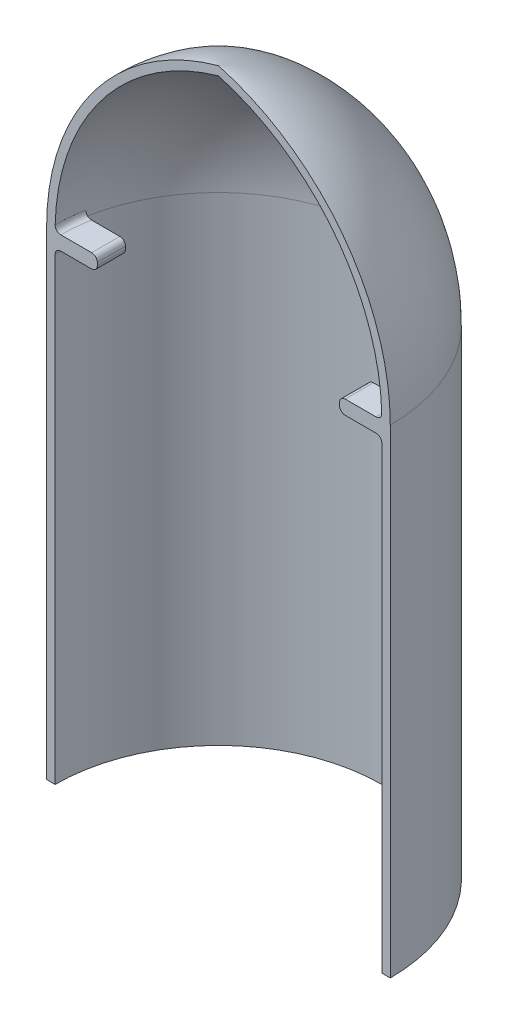
from build123d import *

# Parameters (mm, degrees)
REVOLVE1_ANGLE      = 180
SKETCH2_W           = 15
SKETCH2_H           = 5
BOSS_EXTRUDE1_DEPTH = 10
FILLET2_R           = 2
FILLET3_R           = 2
FILLET4_R           = 2
FILLET5_R           = 2
FILLET6_R           = 2


with BuildPart() as part:
    # Sketch1 → Revolve1 (revolve)
    with BuildSketch(Plane.XY):
        with BuildLine():
            Line((61, 170), (61, 0))
            Line((61, 0), (58, 0))
            Line((58, 0), (58, 170))
            ThreePointArc((58, 170), (41.873834296, 218.154039035), (0, 246.884627213))
            Line((0, 246.884627213), (0, 250))
            ThreePointArc((0, 250), (44.010282534, 220.301590432), (61, 170))
        make_face()
    revolve(axis=Axis((0, 0, 0), (0, 1, 0)), revolution_arc=REVOLVE1_ANGLE)

    # Sketch2 → Boss-Extrude1 (add)
    with BuildSketch(Plane.XY):
        with Locations((50.5, 167.5)):
            Rectangle(SKETCH2_W, SKETCH2_H)
        with Locations((-50.5, 167.5)):
            Rectangle(SKETCH2_W, SKETCH2_H)
    extrude(amount=-BOSS_EXTRUDE1_DEPTH)

    # Fillet2
    # the kernel refuses this fillet: 2 mm, written as the material it adds along each edge
    with BuildSketch(Plane(origin=(0, 170, 0), x_dir=(1, 0, 0), z_dir=(0, 0, 1))) as fillet2_piece_1_section:
        with BuildLine():
            CenterArc((55.974341272, 2), FILLET2_R, 270, 91.470056164)
            Line((55.974341272, 0), (58, 0))
            ThreePointArc((58, 0), (57.993420482, 1.025738909), (57.97368301, 2.051309011))
        make_face()
    fillet2_piece_1 = revolve(axis=Axis((0, 170, 0), (0, 1, 0)), revolution_arc=14.994639912, mode=Mode.PRIVATE)
    fillet2_piece_1 = split(fillet2_piece_1, bisect_by=Plane(origin=(57.246854663, 170.465829225, -10), z_dir=(0, 0, 1)), keep=Keep.TOP, mode=Mode.PRIVATE)
    add(fillet2_piece_1)
    with BuildSketch(Plane(origin=(0, 170, 0), x_dir=(-0.9659500348920197, 0, -0.2587286804590979), z_dir=(0.2587286804590979, 0, -0.9659500348920197))) as fillet2_piece_2_section:
        with BuildLine():
            CenterArc((55.974341272, 2), FILLET2_R, 270, 91.470056164)
            Line((55.974341272, 0), (58, 0))
            ThreePointArc((58, 0), (57.993420482, 1.025738909), (57.97368301, 2.051309011))
        make_face()
    fillet2_piece_2 = revolve(axis=Axis((0, 170, 0), (0, 1, 0)), revolution_arc=14.994639912, mode=Mode.PRIVATE)
    fillet2_piece_2 = split(fillet2_piece_2, bisect_by=Plane(origin=(-57.246854909, 170.465829269, -10), z_dir=(0, 0, 1)), keep=Keep.TOP, mode=Mode.PRIVATE)
    add(fillet2_piece_2)
    # the kernel refuses this fillet: 2 mm, written as the material it takes off along each edge
    with BuildSketch(Plane(origin=(43, 170, 5), x_dir=(0, -1, 0), z_dir=(0, 0, -1)), Plane(origin=(-43, 170, 5), x_dir=(-1, 0, 0), z_dir=(0, 0, -1))) as fillet2_2_piece_1:
        with BuildLine():
            CenterArc((FILLET2_R, -FILLET2_R), FILLET2_R, 90, 90)
            Line((0, -FILLET2_R), (0, 0))
            Line((0, 0), (FILLET2_R, 0))
        make_face()
    extrude(amount=20, mode=Mode.SUBTRACT)

    # Fillet3
    fillet3_edges = [part.edges().sort_by_distance(p)[0] for p in [
        (57.782448853, 165, -5.01882502),
    ]]
    fillet(fillet3_edges, radius=FILLET3_R)

    # Fillet4
    fillet4_edges = [part.edges().sort_by_distance(p)[0] for p in [
        (-57.782448853, 165, -5.01882502),
    ]]
    fillet(fillet4_edges, radius=FILLET4_R)

    # Fillet5
    fillet5_edges = [part.edges().sort_by_distance(p)[0] for p in [
        (-43, 165, -5),
    ]]
    fillet(fillet5_edges, radius=FILLET5_R)

    # Fillet6
    fillet6_edges = [part.edges().sort_by_distance(p)[0] for p in [
        (43, 165, -5),
    ]]
    fillet(fillet6_edges, radius=FILLET6_R)


solid = part.part
